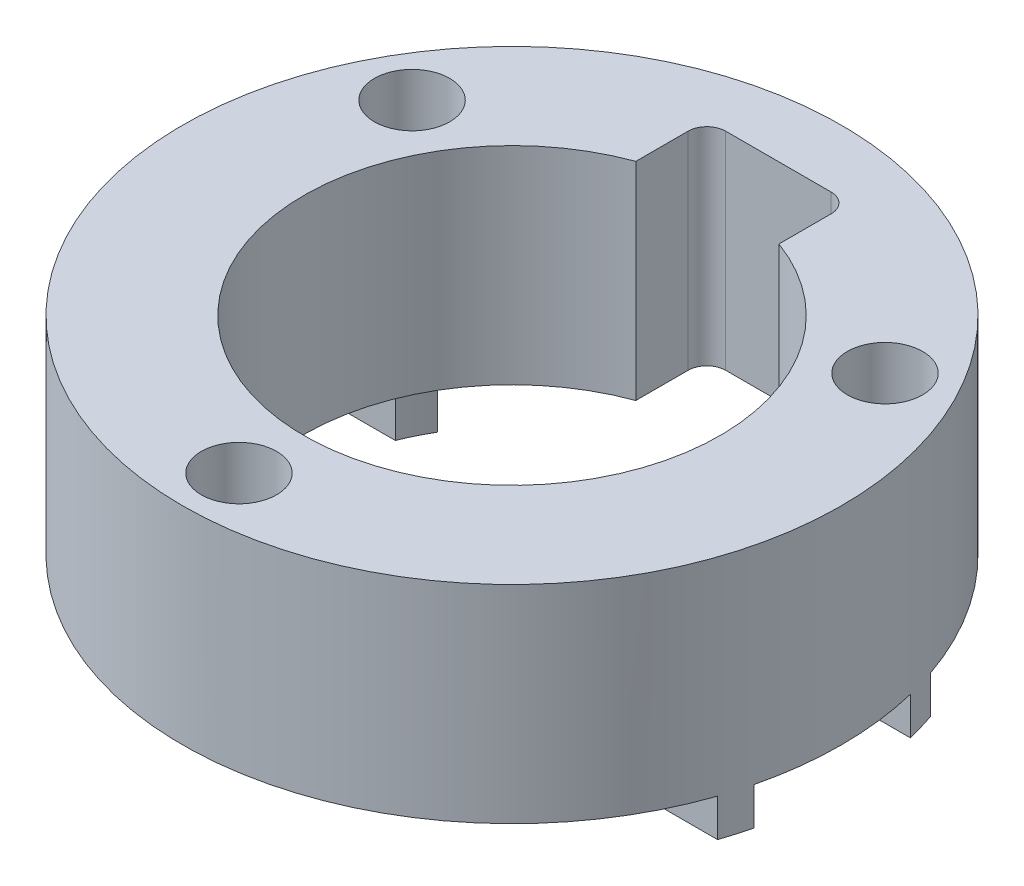
from build123d import *

# Parameters (mm, degrees)
CROQUIS1_R              = 17.5
SALIENTE_EXTRUIR1_DEPTH = 11
CROQUIS4_R              = 2
CORTAR_EXTRUIR2_DEPTH   = 28.083205128
CROQUIS6_R              = 2
CORTAR_EXTRUIR3_DEPTH   = 4
SALIENTE_EXTRUIR3_DEPTH = 2
SALIENTE_EXTRUIR4_START = -11
SALIENTE_EXTRUIR4_DEPTH = 11


# Read off the part's stored shape, not the designer's step: Saliente-Extruir3
with BuildPart() as part:
    # Croquis1 → Saliente-Extruir1 (new body)
    with BuildSketch(Plane(origin=(0, 0, 0), x_dir=(1, 0, 0), z_dir=(0, 1, 0))):
        with Locations(Location((0, 0, 0), (0, 0, 270))):
            Circle(CROQUIS1_R)
        with BuildLine():
            ThreePointArc((11.15, 0), (-6.401269405, -9.129416739), (-3.8, 10.482485392))
            Line((-3.8, 10.482485392), (-3.8, 13.15))
            ThreePointArc((-3.8, 13.15), (-3.507106781, 13.857106781), (-2.8, 14.15))
            Line((-2.8, 14.15), (2.8, 14.15))
            ThreePointArc((2.8, 14.15), (3.507106781, 13.857106781), (3.8, 13.15))
            Line((3.8, 13.15), (3.8, 10.482485392))
            ThreePointArc((3.8, 10.482485392), (9.129416739, 6.401269405), (11.15, 0))
        make_face(mode=Mode.SUBTRACT)
    extrude(amount=SALIENTE_EXTRUIR1_DEPTH)

    # Croquis4 → Cortar-Extruir2 (cut, through all)
    with BuildSketch(Plane(origin=(0, 11, 0), x_dir=(1, 0, 0), z_dir=(0, 1, 0))):
        with Locations(Location((-12.557368355, 7.25, 0), (0, 0, 270))):
            Circle(CROQUIS4_R)
        with Locations(Location((12.557368355, 7.25, 0), (0, 0, 270))):
            Circle(CROQUIS4_R)
        with Locations(Location((0, -14.5, 0), (0, 0, 270))):
            Circle(CROQUIS4_R)
    extrude(amount=-CORTAR_EXTRUIR2_DEPTH, mode=Mode.SUBTRACT)

    # Croquis6 → Cortar-Extruir3 (cut)
    with BuildSketch(Plane(origin=(0, 0, 0), x_dir=(-1, 0, 0), z_dir=(0, -1, 0))):
        with Locations(Location((14.325, 0, 0), (0, 0, 90))):
            Circle(CROQUIS6_R)
        with Locations(Location((-14.325, 0, 0), (0, 0, 270))):
            Circle(CROQUIS6_R)
    extrude(amount=-CORTAR_EXTRUIR3_DEPTH, mode=Mode.SUBTRACT)

    # Saliente-Extruir3 outline → Saliente-Extruir3 (add)
    with BuildSketch(Plane(origin=(0, 0, 0), x_dir=(-1, 0, 0), z_dir=(0, -1, 0))):
        with BuildLine():
            ThreePointArc((-10.348912986, 4.15), (-10.00884214, 4.913815118), (-9.612491872, 5.65))
            Line((-9.612491872, 5.65), (-11.357368355, 5.65))
            ThreePointArc((-11.357368355, 5.65), (-12.557368355, 5.25), (-13.757368355, 5.65))
            Line((-13.757368355, 5.65), (-16.562834902, 5.65))
            ThreePointArc((-16.562834902, 5.65), (-16.798572699, 4.904890956), (-17.000808804, 4.15))
            Line((-17.000808804, 4.15), (-10.348912986, 4.15))
        make_face()
        with BuildLine():
            ThreePointArc((-9.612491873, -5.65), (-10.00884214, -4.913815118), (-10.348912986, -4.15))
            Line((-10.348912986, -4.15), (-17.000808804, -4.15))
            ThreePointArc((-17.000808804, -4.15), (-16.798572699, -4.904890956), (-16.562834902, -5.65))
            Line((-16.562834902, -5.65), (-9.612491873, -5.65))
        make_face()
        with BuildLine():
            ThreePointArc((10.348912986, -4.15), (10.00884214, -4.913815118), (9.612491873, -5.65))
            Line((9.612491873, -5.65), (16.562834902, -5.65))
            ThreePointArc((16.562834902, -5.65), (16.798572699, -4.904890956), (17.000808804, -4.15))
            Line((17.000808804, -4.15), (10.348912986, -4.15))
        make_face()
        with BuildLine():
            ThreePointArc((17.000808804, 4.15), (16.798572699, 4.904890956), (16.562834902, 5.65))
            Line((16.562834902, 5.65), (13.757368355, 5.65))
            ThreePointArc((13.757368355, 5.65), (12.557368355, 5.25), (11.357368355, 5.65))
            Line((11.357368355, 5.65), (9.612491872, 5.65))
            ThreePointArc((9.612491872, 5.65), (10.00884214, 4.913815118), (10.348912986, 4.15))
            Line((10.348912986, 4.15), (17.000808804, 4.15))
        make_face()
    extrude(amount=SALIENTE_EXTRUIR3_DEPTH)

    # Croquis11 → Saliente-Extruir4 (add)
    with BuildSketch(Plane(origin=(0, 11, 0), x_dir=(1, 0, 0), z_dir=(0, 1, 0)).offset(SALIENTE_EXTRUIR4_START)):
        with BuildLine():
            Line((-3.8, 10.376054163), (-3.8, 10.482485392))
            ThreePointArc((-3.8, 10.482485392), (-6.401269405, -9.129416739), (11.15, 0))
            ThreePointArc((11.15, 0), (9.129416739, 6.401269405), (3.8, 10.482485392))
            Line((3.8, 10.482485392), (3.8, 10.376054163))
            ThreePointArc((3.8, 10.376054163), (9.057938507, 6.329000711), (11.05, 0))
            ThreePointArc((11.05, 0), (-6.329000711, -9.057938507), (-3.8, 10.376054163))
        make_face()
    extrude(amount=SALIENTE_EXTRUIR4_DEPTH)


solid = part.part
